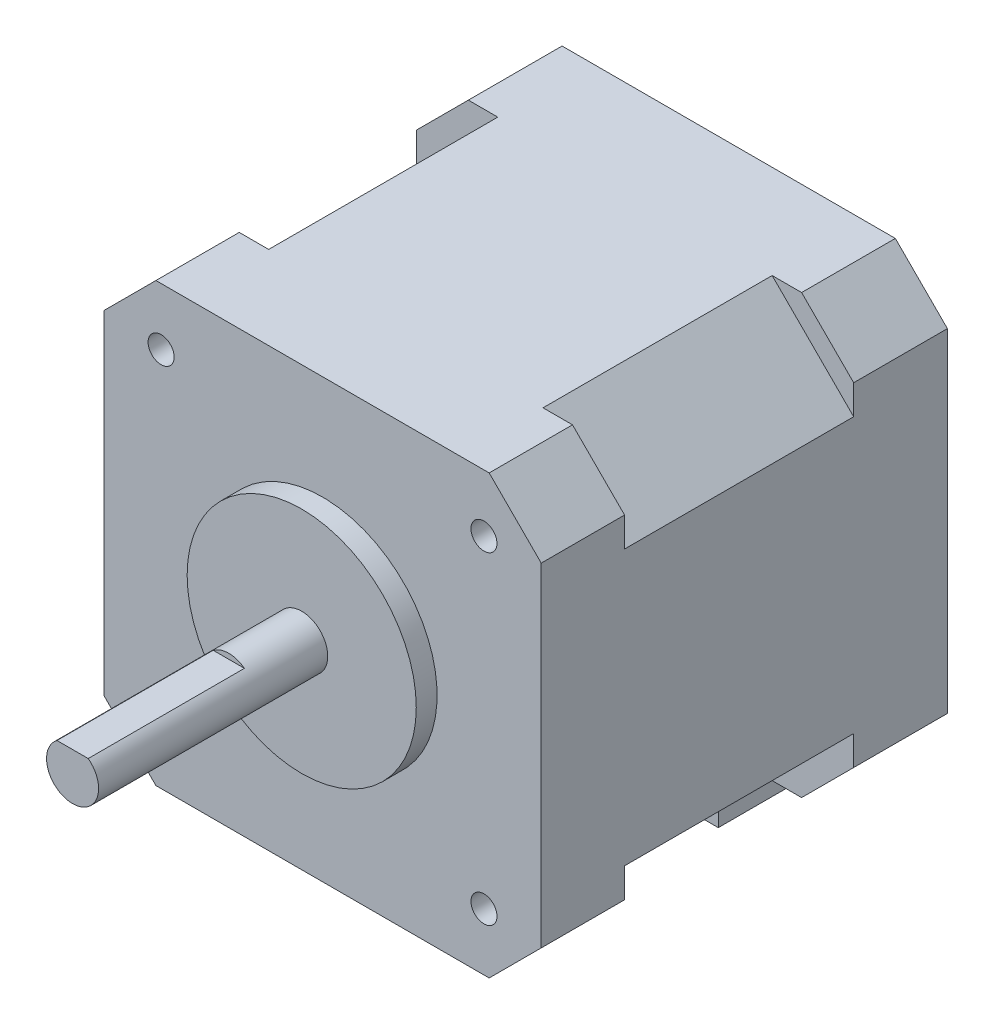
from build123d import *

# Parameters (mm, degrees)
SKETCH1_W           = 42
SKETCH1_H           = 42
BOSS_EXTRUDE1_DEPTH = 39
CHAMFER1_SIZE       = 5
SKETCH5_R           = 11
SKETCH5_R_2         = 2.5
BOSS_EXTRUDE2_DEPTH = 2
SKETCH6_R           = 2.5
BOSS_EXTRUDE3_DEPTH = 24
SKETCH7_W           = 5.502287021
SKETCH7_H           = 7.880652758
CUT_EXTRUDE1_DEPTH  = 15
SKETCH8_W           = 16
SKETCH8_H           = 13
BOSS_EXTRUDE4_DEPTH = 11
CUT_EXTRUDE2_START  = -8
SKETCH9_W           = 84.832687132
SKETCH9_H           = 82.051636753
CUT_EXTRUDE2_DEPTH  = 22


# Read off the part's stored shape, not the designer's step: M3x0.5 Tapped Hole1
with BuildPart() as part:
    # Sketch1 → Boss-Extrude1 (new body)
    with BuildSketch(Plane.XY):
        Rectangle(SKETCH1_W, SKETCH1_H)
    extrude(amount=BOSS_EXTRUDE1_DEPTH)

    # Chamfer1
    chamfer1_edges = [part.edges().sort_by_distance(p)[0] for p in [
        (21, -21, 19.5),
        (-21, -21, 19.5),
        (-21, 21, 19.5),
        (21, 21, 19.5),
    ]]
    chamfer(chamfer1_edges, length=CHAMFER1_SIZE)

    # M3x0.5 Tapped Hole1 outline → M3x0.5 Tapped Hole1 (revolve, cut)
    with BuildSketch(Plane(origin=(15.5, 15.5, 0), x_dir=(1, 0, 0), z_dir=(0, -1, 0))):
        Polygon((0, 39), (0, 33.748924226), (1.25, 34.5), (1.25, 39), align=None)
    revolve(axis=Axis((15.5, 15.5, 0), (0, 0, 1)), mode=Mode.SUBTRACT)

    # M3x0.5 Tapped Hole1 2 outline → M3x0.5 Tapped Hole1 2 (revolve, cut)
    with BuildSketch(Plane(origin=(-15.5, -15.5, 0), x_dir=(1, 0, 0), z_dir=(0, -1, 0))):
        Polygon((0, 39), (0, 33.748924226), (1.25, 34.5), (1.25, 39), align=None)
    revolve(axis=Axis((-15.5, -15.5, 0), (0, 0, 1)), mode=Mode.SUBTRACT)

    # M3x0.5 Tapped Hole1 3 outline → M3x0.5 Tapped Hole1 3 (revolve, cut)
    with BuildSketch(Plane(origin=(-15.5, 15.5, 0), x_dir=(1, 0, 0), z_dir=(0, -1, 0))):
        Polygon((0, 39), (0, 33.748924226), (1.25, 34.5), (1.25, 39), align=None)
    revolve(axis=Axis((-15.5, 15.5, 0), (0, 0, 1)), mode=Mode.SUBTRACT)

    # M3x0.5 Tapped Hole1 4 outline → M3x0.5 Tapped Hole1 4 (revolve, cut)
    with BuildSketch(Plane(origin=(15.5, -15.5, 0), x_dir=(1, 0, 0), z_dir=(0, -1, 0))):
        Polygon((0, 39), (0, 33.748924226), (1.25, 34.5), (1.25, 39), align=None)
    revolve(axis=Axis((15.5, -15.5, 0), (0, 0, 1)), mode=Mode.SUBTRACT)

    # Sketch5 → Boss-Extrude2 (add)
    with BuildSketch(Plane.XY.offset(39)):
        with Locations(Location((0, 0, 0), (0, 0, 180))):
            Circle(SKETCH5_R)
        Circle(SKETCH5_R_2, mode=Mode.SUBTRACT)
    extrude(amount=BOSS_EXTRUDE2_DEPTH)

    # Sketch6 → Boss-Extrude3 (add)
    with BuildSketch(Plane.XY.offset(39)):
        Circle(SKETCH6_R)
    extrude(amount=BOSS_EXTRUDE3_DEPTH)

    # Sketch7 → Cut-Extrude1 (cut)
    with BuildSketch(Plane.XY.offset(63)):
        with Locations((1.25114351, 5.940326379)):
            Rectangle(SKETCH7_W, SKETCH7_H)
    extrude(amount=-CUT_EXTRUDE1_DEPTH, mode=Mode.SUBTRACT)

    # Sketch8 → Boss-Extrude4 (add)
    with BuildSketch(Plane(origin=(0, 0, 0), x_dir=(-1, 0, 0), z_dir=(0, 0, -1))):
        with Locations((0, -21)):
            Rectangle(SKETCH8_W, SKETCH8_H)
    extrude(amount=-BOSS_EXTRUDE4_DEPTH)

    # Sketch9 → Cut-Extrude2 (cut)
    with BuildSketch(Plane.XY.offset(39).offset(CUT_EXTRUDE2_START)):
        with Locations((-5.67946535, 2.529712031)):
            Rectangle(SKETCH9_W, SKETCH9_H)
        Polygon((-34.171572875, 0), (0, 34.171572875), (34.171572875, 0), (0, -34.171572875), align=None, mode=Mode.SUBTRACT)
    extrude(amount=-CUT_EXTRUDE2_DEPTH, mode=Mode.SUBTRACT)


solid = part.part
